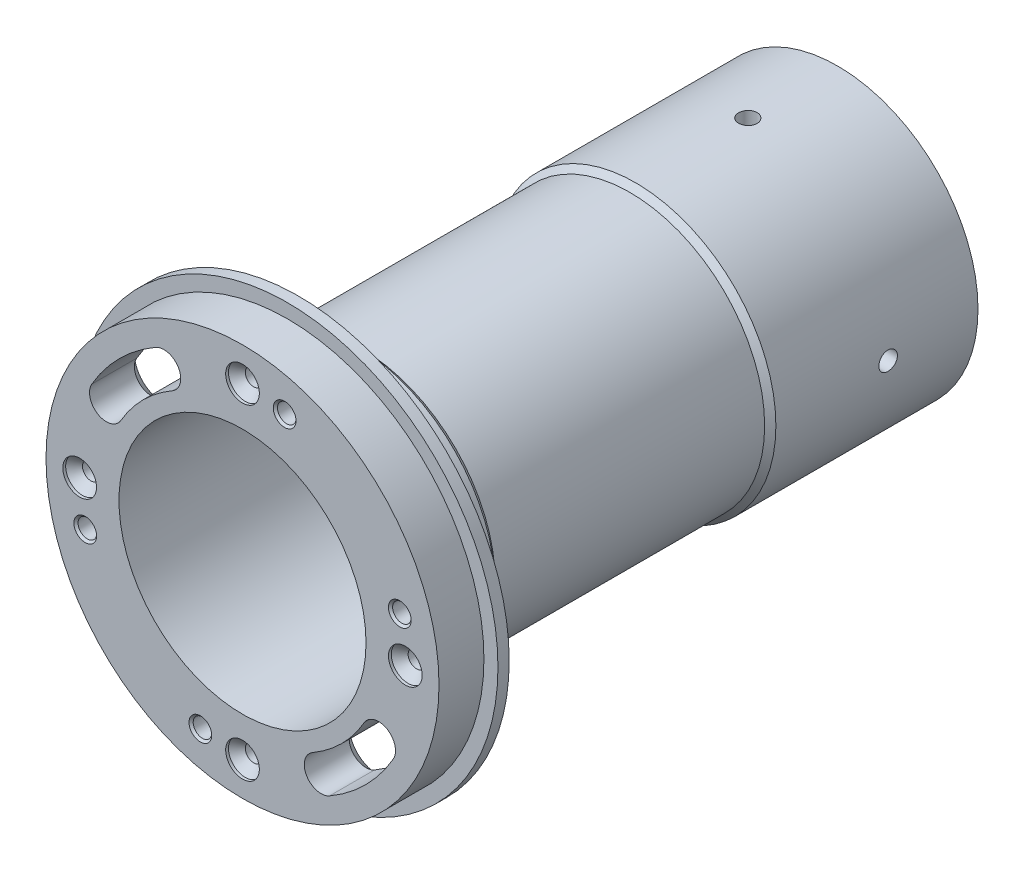
from build123d import *
from build123d.topology import SkipClean

# Parameters (mm, degrees)
EXTRUDE_START                = 8
SKETCH_5_R                   = 35
SKETCH_5_R_2                 = 22
EXTRUDE_1_DEPTH              = 8
SKETCH_9_W                   = 1.65
SKETCH_9_H                   = 37.5
SKETCH_2_R                   = 1.5
CUT_EXTRUDE_1_DEPTH          = 110.674519
PATTERN_CIRCULAR_1_COUNT     = 4
HOLE_WIZARD_M4_4_D           = 3.3
HOLE_WIZARD_M4_4_CSINK_D     = 4.05
HOLE_WIZARD_M4_4_CSINK_ANGLE = 90
HOLE_WIZARD_1_AT_2_COUNT     = 2
HOLE_WIZARD_1_AT_2_PITCH     = 41.012193
HOLE_WIZARD_1_AT_3_COUNT     = 2
HOLE_WIZARD_1_AT_3_PITCH     = 58
HOLE_WIZARD_1_AT_4_COUNT     = 2
HOLE_WIZARD_1_AT_4_PITCH     = 41.012193
CHAMFER_1_SIZE               = 2
CHAMFER_2_SIZE               = 1


# Some blends are built 0.0001 mm under size
with BuildPart() as part:
    # 草图1 → 旋转1 (revolve)
    with BuildSketch(Plane(origin=(0, 0, 0), x_dir=(1, 0, 0), z_dir=(0, 1, 0))):
        Polygon((37.5, 0), (37.5, 2), (25, 2), (25, 12), (24, 12), (24, 62), (25, 62), (25, 98), (22, 98), (22, 0), align=None)
    revolve(axis=Axis((0, 0, 0), (0, 0, -1)))

    # 草图5 → 凸台-拉伸1 (add)
    with BuildSketch(Plane.XY.offset(EXTRUDE_START)):
        Circle(SKETCH_5_R)
        Circle(SKETCH_5_R_2, mode=Mode.SUBTRACT)
    extrude(amount=-EXTRUDE_1_DEPTH)

    # 草图9 → M4 螺纹孔2 (revolve, cut)
    with BuildSketch(Plane(origin=(0, 0, -82), x_dir=(0, 0, -1), z_dir=(1, 0, 0))):
        with Locations((0.825, 18.75)):
            Rectangle(SKETCH_9_W, SKETCH_9_H)
    hole_wizard_m4_2 = revolve(axis=Axis((0, -6.35, -82), (0, 1, 0)), mode=Mode.SUBTRACT)

    # 草图2 → 切除-拉伸1 (cut, through all)
    with SkipClean():  # the faces are left unmerged after this step: merging them gives an invalid solid
        with BuildSketch(Plane(origin=(0, 0, -2), x_dir=(-1, 0, 0), z_dir=(0, 0, -1))):
            with Locations((0, 29)):
                Circle(SKETCH_2_R)
            with Locations((29, 0)):
                Circle(SKETCH_2_R)
            with Locations((0, -29)):
                Circle(SKETCH_2_R)
            with Locations((-29, 0)):
                Circle(SKETCH_2_R)
            with BuildLine():
                ThreePointArc((26.846788, 15.5), (21.92031, 21.92031), (15.5, 26.846788))
                ThreePointArc((15.5, 26.846788), (11.401924, 25.748711), (12.5, 21.650635))
                ThreePointArc((12.5, 21.650635), (17.67767, 17.67767), (21.650635, 12.5))
                ThreePointArc((21.650635, 12.5), (25.748711, 11.401924), (26.846788, 15.5))
            make_face()
            with BuildLine():
                ThreePointArc((-26.846788, -15.5), (-21.92031, -21.92031), (-15.5, -26.846788))
                ThreePointArc((-15.5, -26.846788), (-11.401924, -25.748711), (-12.5, -21.650635))
                ThreePointArc((-12.5, -21.650635), (-17.67767, -17.67767), (-21.650635, -12.5))
                ThreePointArc((-21.650635, -12.5), (-25.748711, -11.401924), (-26.846788, -15.5))
            make_face()
        extrude(amount=-CUT_EXTRUDE_1_DEPTH, mode=Mode.SUBTRACT)

    # 阵列(圆周)1: M4 螺纹孔2 ×4 about axis
    with SkipClean():  # the faces are left unmerged after this step: merging them gives an invalid solid
        pattern_circular_1_axis = Axis((0, 0, 0), (0, 0, -1))
        for i in range(1, PATTERN_CIRCULAR_1_COUNT):
            add(hole_wizard_m4_2.rotate(pattern_circular_1_axis, i * 360 / PATTERN_CIRCULAR_1_COUNT), mode=Mode.SUBTRACT)

    # M4 螺纹孔4 (through all)
    with Locations(Plane.XY.offset(8)):
        with Locations((7.505752, 28.011849), (28.011849, 7.505752), (-7.505752, -28.011849), (-28.011849, -7.505752)):
            CounterSinkHole(HOLE_WIZARD_M4_4_D / 2, HOLE_WIZARD_M4_4_CSINK_D / 2, counter_sink_angle=HOLE_WIZARD_M4_4_CSINK_ANGLE)

    # 草图15 → 孔1 (revolve, cut)
    with SkipClean():  # the faces are left unmerged after this step: merging them gives an invalid solid
        with BuildSketch(Plane(origin=(-29, 0, 8), x_dir=(0, -1, 0), z_dir=(1, 0, 0))):
            Polygon((0, 0), (0, 106), (1.5, 106), (1.5, 2), (3, 0.5), (3, 0), align=None)
        hole_wizard_1 = revolve(axis=Axis((-29, 0, 14.130024), (0, 0, -1)), mode=Mode.SUBTRACT)

    # 孔1 at 2: 孔1 ×2
    with SkipClean():  # the faces are left unmerged after this step: merging them gives an invalid solid
        with Locations(*[Vector(0.7071067811865532, -0.7071067811865418, 0) * (i * HOLE_WIZARD_1_AT_2_PITCH) for i in range(1, HOLE_WIZARD_1_AT_2_COUNT)]):
            add(hole_wizard_1, mode=Mode.SUBTRACT)

    # 孔1 at 3: 孔1 ×2
    with SkipClean():  # the faces are left unmerged after this step: merging them gives an invalid solid
        with Locations(*[(i * HOLE_WIZARD_1_AT_3_PITCH, 0, 0) for i in range(1, HOLE_WIZARD_1_AT_3_COUNT)]):
            add(hole_wizard_1, mode=Mode.SUBTRACT)

    # 孔1 at 4: 孔1 ×2
    with SkipClean():  # the faces are left unmerged after this step: merging them gives an invalid solid
        with Locations(*[Vector(0.7071067811865457, 0.7071067811865495, 0) * (i * HOLE_WIZARD_1_AT_4_PITCH) for i in range(1, HOLE_WIZARD_1_AT_4_COUNT)]):
            add(hole_wizard_1, mode=Mode.SUBTRACT)

    # 倒角1
    # the kernel refuses this chamfer: 2 mm, written as the material it takes off along each edge
    with BuildSketch(Plane(origin=(24.248711, -14, -2), x_dir=(-0.3683025891242999, -0.9297059765562106, 0), z_dir=(0.9297059765562106, -0.3683025891242999, 0))) as chamfer_1_piece_1_section:
        Polygon((3 + CHAMFER_1_SIZE, 0), (3, -CHAMFER_1_SIZE), (3, 0), align=None)
    chamfer_1_piece_1 = revolve(axis=Axis((24.248711, -14, -2), (0, 0, -1)), revolution_arc=278.389028, mode=Mode.PRIVATE)
    chamfer_1_piece_1 = chamfer_1_piece_1 - Plane(origin=(0, 0, -1.316198), x_dir=(1, 0, 0), z_dir=(0, 0, -1)) * Cylinder(25, 21, mode=Mode.PRIVATE)
    add(chamfer_1_piece_1, mode=Mode.SUBTRACT)
    with BuildSketch(Plane(origin=(0, 0, -2), x_dir=(0.866025403784439, -0.49999999999999944, 0), z_dir=(0.49999999999999944, 0.866025403784439, 0))) as chamfer_1_piece_2:
        Polygon((31 + CHAMFER_1_SIZE, 0), (31, -CHAMFER_1_SIZE), (31, 0), align=None)
    revolve(axis=Axis((0, 0, -2), (0, 0, -1)), revolution_arc=30, mode=Mode.SUBTRACT)
    with BuildSketch(Plane(origin=(14, -24.248711, -2), x_dir=(0.5, -0.8660254037844387, 0), z_dir=(0.8660254037844387, 0.5, 0))) as chamfer_1_piece_3_section:
        Polygon((3 + CHAMFER_1_SIZE, 0), (3, -CHAMFER_1_SIZE), (3, 0), align=None)
    chamfer_1_piece_3 = revolve(axis=Axis((14, -24.248711, -2), (0, 0, -1)), revolution_arc=278.389028, mode=Mode.PRIVATE)
    chamfer_1_piece_3 = chamfer_1_piece_3 - Plane(origin=(0, 0, -1.445844), x_dir=(1, 0, 0), z_dir=(0, 0, -1)) * Cylinder(25, 21, mode=Mode.PRIVATE)
    add(chamfer_1_piece_3, mode=Mode.SUBTRACT)
    with BuildSketch(Plane(origin=(-24.248711, 14, -2), x_dir=(0.368302589124304, 0.9297059765562089, 0), z_dir=(-0.9297059765562089, 0.368302589124304, 0))) as chamfer_1_piece_4_section:
        Polygon((3 + CHAMFER_1_SIZE, 0), (3, -CHAMFER_1_SIZE), (3, 0), align=None)
    chamfer_1_piece_4 = revolve(axis=Axis((-24.248711, 14, -2), (0, 0, -1)), revolution_arc=278.389028, mode=Mode.PRIVATE)
    chamfer_1_piece_4 = chamfer_1_piece_4 - Plane(origin=(0, 0, -1.316197), x_dir=(1, 0, 0), z_dir=(0, 0, -1)) * Cylinder(25, 21, mode=Mode.PRIVATE)
    add(chamfer_1_piece_4, mode=Mode.SUBTRACT)
    with BuildSketch(Plane(origin=(0, 0, -2), x_dir=(-0.8660254037844394, 0.4999999999999989, 0), z_dir=(-0.4999999999999989, -0.8660254037844394, 0))) as chamfer_1_piece_5:
        Polygon((31 + CHAMFER_1_SIZE, 0), (31, -CHAMFER_1_SIZE), (31, 0), align=None)
    revolve(axis=Axis((0, 0, -2), (0, 0, -1)), revolution_arc=30, mode=Mode.SUBTRACT)
    with BuildSketch(Plane(origin=(-14, 24.248711, -2), x_dir=(-0.5000000000000014, 0.8660254037844378, 0), z_dir=(-0.8660254037844378, -0.5000000000000014, 0))) as chamfer_1_piece_6_section:
        Polygon((3 + CHAMFER_1_SIZE, 0), (3, -CHAMFER_1_SIZE), (3, 0), align=None)
    chamfer_1_piece_6 = revolve(axis=Axis((-14, 24.248711, -2), (0, 0, -1)), revolution_arc=278.389028, mode=Mode.PRIVATE)
    chamfer_1_piece_6 = chamfer_1_piece_6 - Plane(origin=(0, 0, -1.445844), x_dir=(1, 0, 0), z_dir=(0, 0, -1)) * Cylinder(25, 20, mode=Mode.PRIVATE)
    add(chamfer_1_piece_6, mode=Mode.SUBTRACT)

    # 倒角2
    chamfer_2_edges = [part.edges().sort_by_distance(p)[0] for p in [
        (-24, 0, -62),
        (-24, 0, -12),
    ]]
    chamfer(chamfer_2_edges, length=CHAMFER_2_SIZE - 0.0001)  # a hair under: the kernel refuses the full size


solid = part.part
